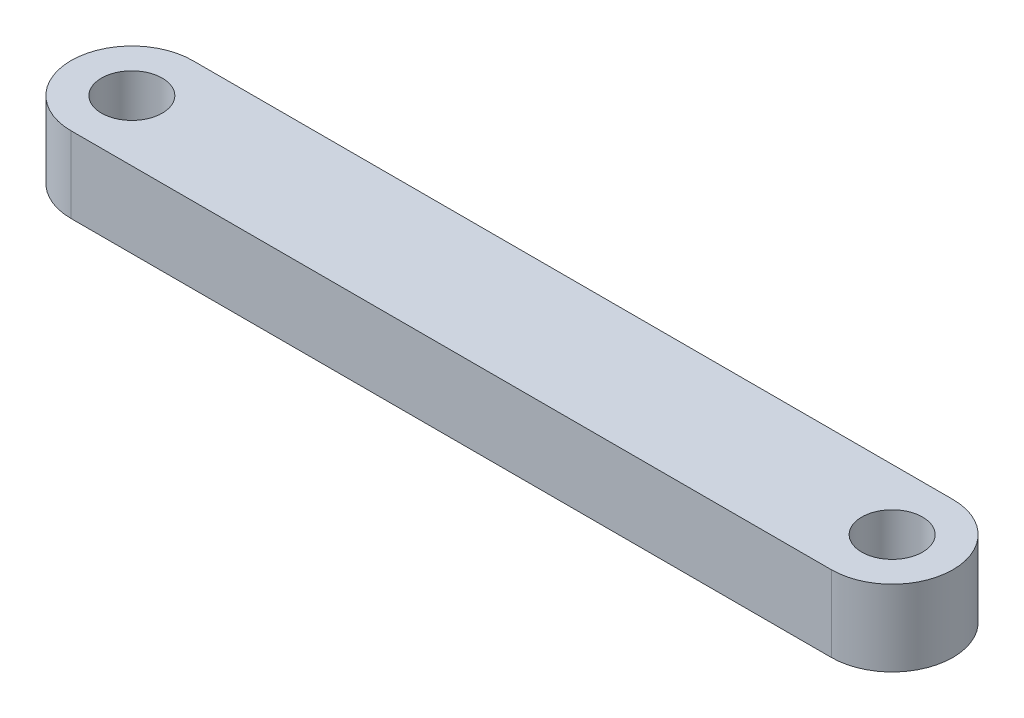
from build123d import *

# Parameters (mm, degrees)
SKETCH_1_R      = 2
EXTRUDE_1_DEPTH = 5


with BuildPart() as part:
    # 草圖1 → 填料-伸長1 (new body)
    with BuildSketch(Plane(origin=(0, 0, 0), x_dir=(1, 0, 0), z_dir=(0, 1, 0))):
        with BuildLine():
            Line((-25, 4), (25, 4))
            ThreePointArc((25, 4), (29, 0), (25, -4))
            Line((25, -4), (-25, -4))
            ThreePointArc((-25, -4), (-29, 0), (-25, 4))
        make_face()
        with Locations((-25, 0)):
            Circle(SKETCH_1_R, mode=Mode.SUBTRACT)
        with Locations((25, 0)):
            Circle(SKETCH_1_R, mode=Mode.SUBTRACT)
    extrude(amount=EXTRUDE_1_DEPTH)


solid = part.part
